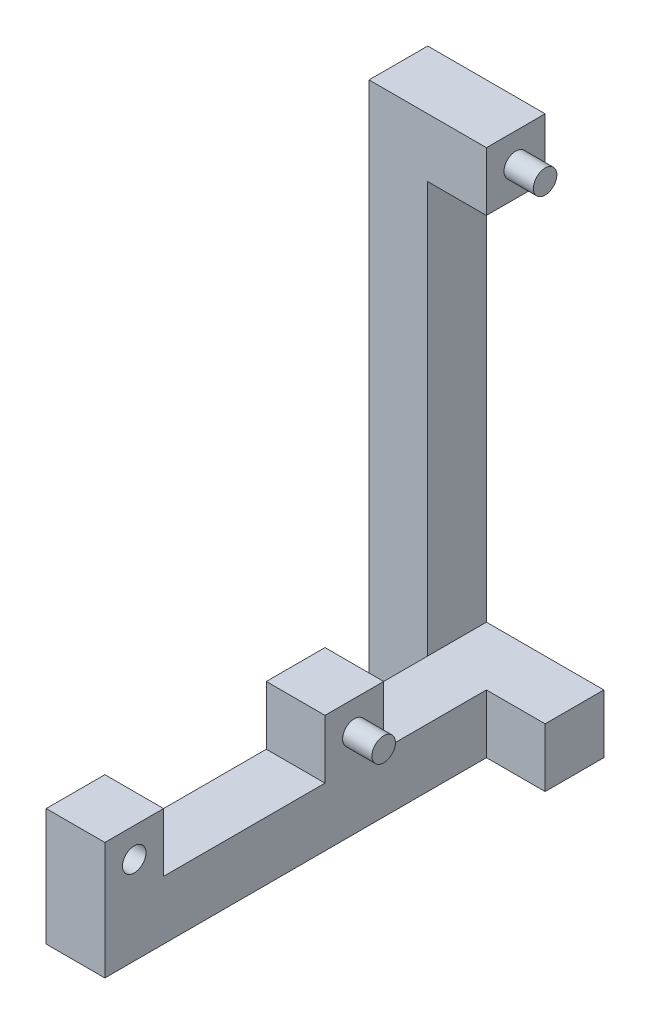
from build123d import *

# Parameters (mm, degrees)
LOWERBASE_W             = 200
LOWERBASE_H             = 200
BOSS_EXTRUDE1_DEPTH     = 200
UPPERBASE_W             = 200
UPPERBASE_H             = 1800
BOSS_EXTRUDE2_DEPTH     = 200
TOPPIVOT_W              = 200
TOPPIVOT_H              = 200
BOSS_EXTRUDE3_DEPTH     = 200
PRESSTABLE_W            = 200
PRESSTABLE_H            = 200
BOSS_EXTRUDE4_DEPTH     = 400
MIDDLERIVET_R           = 40
BOSS_EXTRUDE5_DEPTH     = 300
TOPRIVET_R              = 40
BOSS_EXTRUDE6_DEPTH     = 300
CUT_EXTRUDE1_DEPTH      = 2377.972864801
CUT_EXTRUDE1_DEPTH_BACK = 2377.972864801
SKETCH6_R               = 40


with BuildPart() as part:
    # LowerBase → Boss-Extrude1 (new body)
    with BuildSketch(Plane(origin=(0, 0, 0), x_dir=(0, 0, -1), z_dir=(1, 0, 0))):
        Polygon((-1500, 0), (0, 0), (0, 200), (-550, 200), (-750, 200), (-1300, 200), (-1500, 200), align=None)
        with Locations((-1400, 300)):
            Rectangle(LOWERBASE_W, LOWERBASE_H)
        with Locations((-650, 300)):
            Rectangle(LOWERBASE_W, LOWERBASE_H)
    extrude(amount=BOSS_EXTRUDE1_DEPTH)

    # UpperBase → Boss-Extrude2 (add)
    with BuildSketch(Plane(origin=(0, 0, 0), x_dir=(0, 0, -1), z_dir=(1, 0, 0))):
        with Locations((-100, 900)):
            Rectangle(UPPERBASE_W, UPPERBASE_H)
    extrude(amount=-BOSS_EXTRUDE2_DEPTH)

    # TopPivot → Boss-Extrude3 (add)
    with BuildSketch(Plane(origin=(0, 0, 0), x_dir=(0, 0, -1), z_dir=(1, 0, 0))):
        with Locations((-100, 1700)):
            Rectangle(TOPPIVOT_W, TOPPIVOT_H)
    extrude(amount=BOSS_EXTRUDE3_DEPTH)

    # PressTable → Boss-Extrude4 (add)
    with BuildSketch(Plane(origin=(0, 0, 0), x_dir=(0, 0, -1), z_dir=(1, 0, 0))):
        with Locations((-100, 100)):
            Rectangle(PRESSTABLE_W, PRESSTABLE_H)
    extrude(amount=BOSS_EXTRUDE4_DEPTH)

    # MiddleRivet → Boss-Extrude5 (add)
    with BuildSketch(Plane(origin=(0, 0, 0), x_dir=(0, 0, -1), z_dir=(1, 0, 0))):
        with Locations((-650, 300)):
            Circle(MIDDLERIVET_R)
    extrude(amount=BOSS_EXTRUDE5_DEPTH)

    # TopRivet → Boss-Extrude6 (add)
    with BuildSketch(Plane(origin=(0, 0, 0), x_dir=(0, 0, -1), z_dir=(1, 0, 0))):
        with Locations((-100, 1700)):
            Circle(TOPRIVET_R)
    extrude(amount=BOSS_EXTRUDE6_DEPTH)

    # Sketch6 → Cut-Extrude1 (cut, two sides: drawn at the far end of the back side and taken through both)
    with BuildSketch(Plane(origin=(0, 0, 0), x_dir=(0, 0, -1), z_dir=(1, 0, 0)).offset(-CUT_EXTRUDE1_DEPTH_BACK)):
        with Locations((-1400, 300)):
            Circle(SKETCH6_R)
    extrude(amount=CUT_EXTRUDE1_DEPTH + CUT_EXTRUDE1_DEPTH_BACK, mode=Mode.SUBTRACT)


solid = part.part
